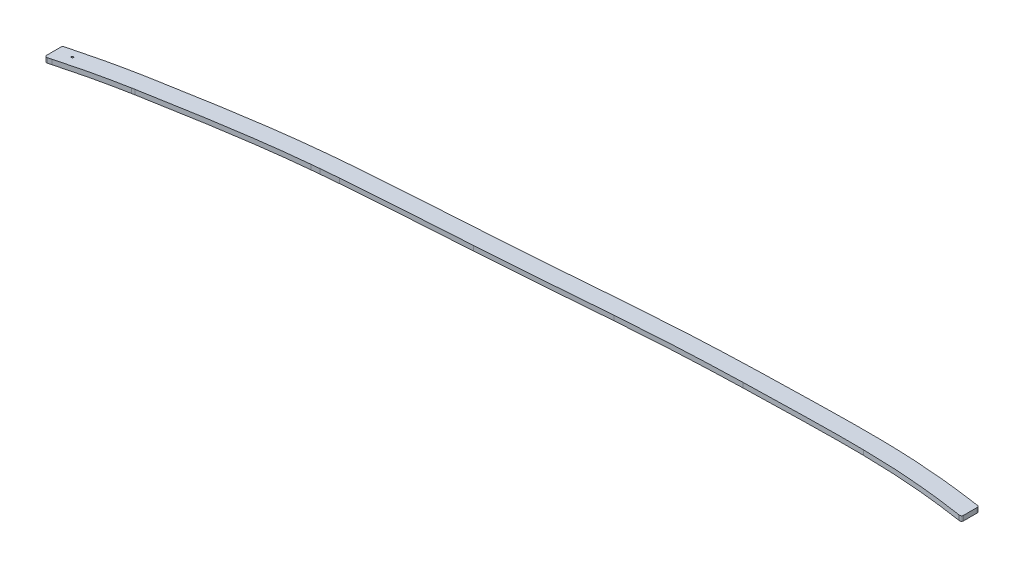
from build123d import *

# Parameters (mm, degrees)
BOSS_EXTRUDE1_OUTLINE_R = 0.635
BOSS_EXTRUDE1_DEPTH     = 3.175
FILLET1_R               = 1.27


with BuildPart() as part:
    # Boss-Extrude1: read off the stored shape, not the designer's step
    # Boss-Extrude1 outline → Boss-Extrude1 (new body)
    with BuildSketch(Plane(origin=(0, 0, 0), x_dir=(1, 0, 0), z_dir=(0, 1, 0))):
        with BuildLine():
            add(Edge.make_bspline(
                [(500.363931332, 100.223117218), (505.904690625, 100.146488345), (516.98978709, 99.849867286), (533.566493845, 98.855153949), (550.078420692, 97.261234107), (561.055884951, 95.814370924), (566.530123356, 95.007503377)],
                knots=[0, 0, 0, 0, 0.238282839, 0.476565677, 0.714848516, 0.953131355, 0.953131355, 0.953131355, 0.953131355], degree=3))
            add(Edge.make_bspline(
                [(421.745937115, 98.991738452), (428.305748156, 99.166301643), (441.425519501, 99.487460571), (461.109158457, 99.948027433), (480.768480262, 100.297767803), (493.828917925, 100.313504897), (500.363931332, 100.223117218)],
                knots=[2.683e-06, 2.683e-06, 2.683e-06, 2.683e-06, 0.250002012, 0.500001342, 0.750000671, 1, 1, 1, 1], degree=3))
            add(Edge.make_bspline(
                [(340.462462002, 94.7897299), (347.224032201, 95.319027204), (360.754286882, 96.282918846), (381.069871528, 97.456302869), (401.400886655, 98.368636041), (414.96379764, 98.810505185), (421.745937115, 98.991738452)],
                knots=[3.435e-06, 3.435e-06, 3.435e-06, 3.435e-06, 0.250001928, 0.50000042, 0.749998913, 0.999997406, 0.999997406, 0.999997406, 0.999997406], degree=3))
            add(Edge.make_bspline(
                [(254.727325479, 88.343859808), (261.87746665, 88.823336878), (276.174869396, 89.799016416), (297.623416106, 91.380630717), (319.058656024, 93.072402004), (333.325074716, 94.22995733), (340.462462002, 94.7897299)],
                knots=[9.51e-07, 9.51e-07, 9.51e-07, 9.51e-07, 0.249999898, 0.499998846, 0.749997793, 0.999996741, 0.999996741, 0.999996741, 0.999996741], degree=3))
            add(Edge.make_bspline(
                [(171.943647819, 82.643083752), (178.827869401, 83.20387), (192.598901149, 84.242258738), (213.291619829, 85.642783935), (234.001733829, 86.980350184), (247.820432283, 87.880397005), (254.727325479, 88.343859808)],
                knots=[-1.79e-07, -1.79e-07, -1.79e-07, -1.79e-07, 0.24999962, 0.499999418, 0.749999217, 0.999999016, 0.999999016, 0.999999016, 0.999999016], degree=3))
            add(Edge.make_bspline(
                [(160.182050495, 81.61265481), (161.161257266, 81.70495935), (163.119828179, 81.886084692), (166.059605792, 82.147991178), (169.000722356, 82.400596631), (170.962655848, 82.563180216), (171.943647819, 82.643083752)],
                knots=[1.061e-06, 1.061e-06, 1.061e-06, 1.061e-06, 0.25000111, 0.500001159, 0.750001208, 1.000001256, 1.000001256, 1.000001256, 1.000001256], degree=3))
            Line((160.182050495, 81.61265481), (154.632395026, 81.077586961))
            add(Edge.make_bspline(
                [(53.079998289, 65.775715516), (61.513898232, 67.319009556), (78.399927581, 70.329047536), (103.756484767, 74.544619134), (129.160124243, 78.262769864), (146.128753825, 80.24430394), (154.632395026, 81.077586961)],
                knots=[5.8856e-05, 5.8856e-05, 5.8856e-05, 5.8856e-05, 0.250044142, 0.500029428, 0.750014714, 1, 1, 1, 1], degree=3))
            Line((53.079998289, 65.775715516), (51.308549202, 65.445740225))
            add(Edge.make_bspline(
                [(10.585897899, 56.224984318), (13.941779162, 57.132062519), (20.672458821, 58.866248382), (30.837264924, 61.257343807), (41.047425931, 63.455573181), (47.885214569, 64.801138415), (51.308549202, 65.445740225)],
                knots=[0.064907657, 0.064907657, 0.064907657, 0.064907657, 0.298680743, 0.532453828, 0.766226914, 1, 1, 1, 1], degree=3))
            Line((10.585897899, 56.224984318), (6.775897899, 55.195160056))
            Line((6.775897899, 55.195160056), (6.775897899, 43.316199984))
            Line((6.775897899, 43.316199984), (10.850234699, 44.446598793))
            add(Edge.make_bspline(
                [(10.850234699, 44.446598793), (14.340342636, 45.414907022), (21.334985759, 47.258123006), (31.953816099, 49.794941322), (42.64150526, 52.117473464), (49.81793576, 53.534111605), (53.409096635, 54.210402111)],
                knots=[0, 0, 0, 0, 0.24991594, 0.499831881, 0.749747821, 0.999663762, 0.999663762, 0.999663762, 0.999663762], degree=3))
            Line((53.409096635, 54.210402111), (55.155253114, 54.535673302))
            add(Edge.make_bspline(
                [(55.155253114, 54.535673302), (63.54774086, 56.071332867), (80.36299007, 59.06858723), (105.540389435, 63.254049355), (130.671339907, 66.93119705), (147.359801836, 68.880042413), (155.735311702, 69.700917089)],
                knots=[0.000236149, 0.000236149, 0.000236149, 0.000236149, 0.250147744, 0.500059338, 0.749970932, 0.999882527, 0.999882527, 0.999882527, 0.999882527], degree=3))
            Line((155.735311702, 69.700917089), (161.270823741, 70.234617305))
            add(Edge.make_bspline(
                [(161.270823741, 70.234617305), (162.235608998, 70.325543269), (164.164816506, 70.503921062), (167.063624178, 70.762146818), (169.965303116, 71.011348444), (171.902999143, 71.171919977), (172.87161313, 71.250815305)],
                knots=[0.001389066, 0.001389066, 0.001389066, 0.001389066, 0.251043056, 0.500697046, 0.750351036, 1.000005026, 1.000005026, 1.000005026, 1.000005026], degree=3))
            add(Edge.make_bspline(
                [(172.87161313, 71.250815305), (179.718410582, 71.808552996), (193.402049653, 72.840364183), (214.038683352, 74.237228358), (234.732110585, 75.573699755), (248.577004917, 76.475460963), (255.492330083, 76.939489241)],
                knots=[-7.18e-07, -7.18e-07, -7.18e-07, -7.18e-07, 0.24999848, 0.499997678, 0.749996876, 0.999996073, 0.999996073, 0.999996073, 0.999996073], degree=3))
            add(Edge.make_bspline(
                [(255.492330083, 76.939489241), (262.657227476, 77.419956035), (276.977734346, 78.397215401), (298.499351954, 79.984114865), (316.393020167, 81.39668078), (330.682169872, 82.547590749), (337.794627544, 83.115396626), (341.355313187, 83.394655636)],
                knots=[3.799e-06, 3.799e-06, 3.799e-06, 3.799e-06, 0.249999576, 0.499995354, 0.749991131, 0.87498902, 0.999986909, 0.999986909, 0.999986909, 0.999986909], degree=3))
            add(Edge.make_bspline(
                [(341.355313187, 83.394655636), (348.06466872, 83.919861633), (361.488791434, 84.876192049), (381.654909862, 86.040969048), (401.841290064, 86.946839421), (415.314276027, 87.385788047), (422.050628462, 87.565800259)],
                knots=[1.3832e-05, 1.3832e-05, 1.3832e-05, 1.3832e-05, 0.250007766, 0.5000017, 0.749995634, 0.999989568, 0.999989568, 0.999989568, 0.999989568], degree=3))
            add(Edge.make_bspline(
                [(422.050628462, 87.565800259), (428.600174065, 87.740089377), (441.696238314, 88.060664748), (461.363367324, 88.520823712), (477.64061994, 88.810121246), (490.573430891, 88.879422902), (496.991230944, 88.838672768), (500.205859595, 88.7942103)],
                knots=[1.0774e-05, 1.0774e-05, 1.0774e-05, 1.0774e-05, 0.250008111, 0.500005448, 0.750002785, 0.875001454, 1.000000122, 1.000000122, 1.000000122, 1.000000122], degree=3))
            add(Edge.make_bspline(
                [(500.205859595, 88.7942103), (503.058403259, 88.754759533), (508.771360909, 88.63685492), (520.125839257, 88.225760782), (534.266224295, 87.340206173), (551.142590634, 85.635354683), (562.414974362, 84.084969045), (568.028462482, 83.22352623)],
                knots=[-1.37e-07, -1.37e-07, -1.37e-07, -1.37e-07, 0.12499988, 0.249999898, 0.499999932, 0.749999966, 1, 1, 1, 1], degree=3))
            Line((568.028462482, 83.22352623), (570.340123356, 82.868780018))
            Line((570.340123356, 82.868780018), (570.340123356, 94.445933872))
            Line((570.340123356, 94.445933872), (566.530123356, 95.007503377))
        make_face()
        with Locations((16.272596326, 52.376396822)):
            Circle(BOSS_EXTRUDE1_OUTLINE_R, mode=Mode.SUBTRACT)
    extrude(amount=BOSS_EXTRUDE1_DEPTH)

    # Fillet1
    fillet1_edges = [part.edges().sort_by_distance(p)[0] for p in [
        (570.340123356, 1.5875, -94.445933872),
        (570.340123356, 1.5875, -82.868780018),
        (6.775897899, 1.5875, -43.316199984),
        (6.775897899, 1.5875, -55.195160056),
    ]]
    fillet(fillet1_edges, radius=FILLET1_R)


solid = part.part
